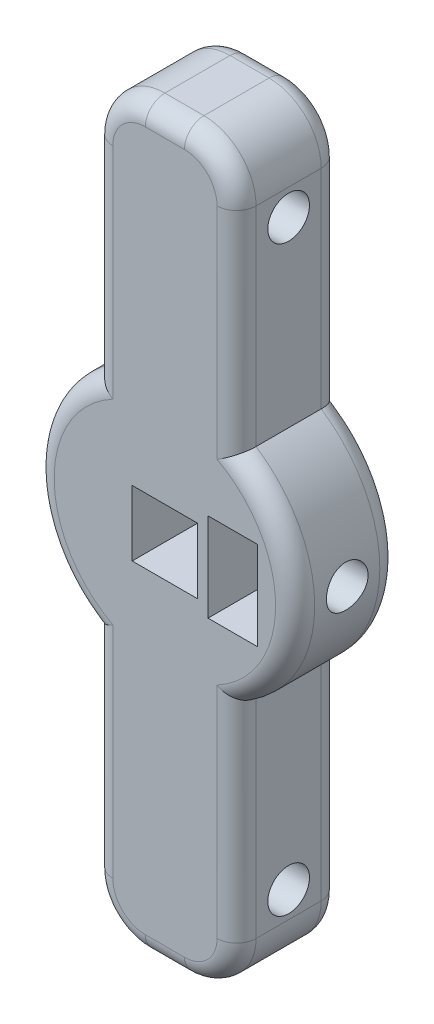
from build123d import *

# Parameters (mm, degrees)
SKETCH2_R           = 2.032
BOSS_EXTRUDE1_DEPTH = 10.16
SKETCH3_W           = 6.38
SKETCH3_H           = 6.38
CUT_EXTRUDE1_DEPTH  = 40.509368553
SKETCH4_R           = 2.032
CUT_EXTRUDE2_DEPTH  = 24.13
FILLET3_R           = 1.905
FILLET1_R           = 5.08
SKETCH5_R           = 2.032
CUT_EXTRUDE3_DEPTH  = 41.64716852
SKETCH7_W           = 10.16
SKETCH7_H           = 8.636
CUT_EXTRUDE4_DEPTH  = 5.842
SKETCH8_W           = 10.16
SKETCH8_H           = 8.636
BOSS_EXTRUDE2_DEPTH = 1.016


with BuildPart() as part:
    # Sketch2 → Boss-Extrude1 (new body)
    with BuildSketch(Plane.XY):
        with BuildLine():
            Line((-6.985, 10.606591111), (-6.985, 36.006591111))
            Line((-6.985, 36.006591111), (6.985, 36.006591111))
            Line((6.985, 36.006591111), (6.985, 10.606591111))
            ThreePointArc((6.985, 10.606591111), (12.7, 0), (6.985, -10.606591111))
            Line((6.985, -10.606591111), (6.985, -36.006591111))
            Line((6.985, -36.006591111), (-6.985, -36.006591111))
            Line((-6.985, -36.006591111), (-6.985, -10.606591111))
            ThreePointArc((-6.985, -10.606591111), (-12.7, 0), (-6.985, 10.606591111))
        make_face()
        Circle(SKETCH2_R, mode=Mode.SUBTRACT)
    extrude(amount=BOSS_EXTRUDE1_DEPTH)

    # Sketch3 → Cut-Extrude1 (cut, through all)
    with BuildSketch(Plane(origin=(0, 0, 0), x_dir=(-1, 0, 0), z_dir=(0, 0, -1))):
        Rectangle(SKETCH3_W, SKETCH3_H)
    extrude(amount=-CUT_EXTRUDE1_DEPTH, mode=Mode.SUBTRACT)

    # Sketch4 → Cut-Extrude2 (cut)
    with BuildSketch(Plane(origin=(6.985, 0, 3.175), x_dir=(0, 0, 1), z_dir=(-1, 0, 0))):
        with Locations(Location((1.905, 28.386591111, 0), (0, 0, 90))):
            Circle(SKETCH4_R)
        with Locations(Location((1.905, -28.386591111, 0), (0, 0, 90))):
            Circle(SKETCH4_R)
    extrude(amount=CUT_EXTRUDE2_DEPTH, mode=Mode.SUBTRACT)

    # Fillet3
    fillet3_edges = [part.edges().sort_by_distance(p)[0] for p in [
        (6.985, 23.306591111, 0),
        (12.7, 0, 0),
        (6.985, -23.306591111, 0),
        (0, -36.006591111, 0),
        (12.7, 0, 10.16),
        (6.985, 23.306591111, 10.16),
        (0, 36.006591111, 10.16),
        (-6.985, 23.306591111, 10.16),
        (-12.7, 0, 10.16),
        (-6.985, -23.306591111, 10.16),
        (0, -36.006591111, 10.16),
        (-6.985, -23.306591111, 0),
        (6.985, -23.306591111, 10.16),
        (-12.7, 0, 0),
        (-6.985, 23.306591111, 0),
        (0, 36.006591111, 0),
    ]]
    fillet(fillet3_edges, radius=FILLET3_R)

    # Fillet1
    # the kernel refuses this fillet: 5.08 mm, written as the material it takes off along each edge
    with BuildSketch(Plane(origin=(-1.905, 30.926591111, 0), x_dir=(-1, 0, 0), z_dir=(0, -1, 0))) as fillet1_piece_1:
        with BuildLine():
            CenterArc((3.175, -1.905), 1.905, 0, 90)
            Line((5.08, -1.905), (5.08, 0))
            Line((5.08, 0), (3.175, 0))
        make_face()
    revolve(axis=Axis((-1.905, 30.926591111, 0), (0, 0, -1)), revolution_arc=90, mode=Mode.SUBTRACT)
    with BuildSketch(Plane(origin=(1.905, 30.926591111, 0), x_dir=(0, 1, 0), z_dir=(-1, 0, 0))) as fillet1_piece_2:
        with BuildLine():
            CenterArc((3.175, -1.905), 1.905, 0, 90)
            Line((5.08, -1.905), (5.08, 0))
            Line((5.08, 0), (3.175, 0))
        make_face()
    revolve(axis=Axis((1.905, 30.926591111, 0), (0, 0, -1)), revolution_arc=90, mode=Mode.SUBTRACT)
    with BuildSketch(Plane(origin=(-1.905, -30.926591111, 0), x_dir=(0, -1, 0), z_dir=(1, 0, 0))) as fillet1_piece_3:
        with BuildLine():
            CenterArc((3.175, -1.905), 1.905, 0, 90)
            Line((5.08, -1.905), (5.08, 0))
            Line((5.08, 0), (3.175, 0))
        make_face()
    revolve(axis=Axis((-1.905, -30.926591111, 0), (0, 0, -1)), revolution_arc=90, mode=Mode.SUBTRACT)
    with BuildSketch(Plane(origin=(1.905, -30.926591111, 0), x_dir=(1, 0, 0), z_dir=(0, 1, 0))) as fillet1_piece_4:
        with BuildLine():
            CenterArc((3.175, -1.905), 1.905, 0, 90)
            Line((5.08, -1.905), (5.08, 0))
            Line((5.08, 0), (3.175, 0))
        make_face()
    revolve(axis=Axis((1.905, -30.926591111, 0), (0, 0, -1)), revolution_arc=90, mode=Mode.SUBTRACT)
    with BuildSketch(Plane(origin=(-1.905, 30.926591111, 10.16), x_dir=(0, 1, 0), z_dir=(1, 0, 0))) as fillet1_piece_5:
        with BuildLine():
            CenterArc((3.175, -1.905), 1.905, 0, 90)
            Line((5.08, -1.905), (5.08, 0))
            Line((5.08, 0), (3.175, 0))
        make_face()
    revolve(axis=Axis((-1.905, 30.926591111, 10.16), (0, 0, 1)), revolution_arc=90, mode=Mode.SUBTRACT)
    with BuildSketch(Plane(origin=(1.905, 30.926591111, 10.16), x_dir=(1, 0, 0), z_dir=(0, -1, 0))) as fillet1_piece_6:
        with BuildLine():
            CenterArc((3.175, -1.905), 1.905, 0, 90)
            Line((5.08, -1.905), (5.08, 0))
            Line((5.08, 0), (3.175, 0))
        make_face()
    revolve(axis=Axis((1.905, 30.926591111, 10.16), (0, 0, 1)), revolution_arc=90, mode=Mode.SUBTRACT)
    with BuildSketch(Plane(origin=(-1.905, -30.926591111, 10.16), x_dir=(-1, 0, 0), z_dir=(0, 1, 0))) as fillet1_piece_7:
        with BuildLine():
            CenterArc((3.175, -1.905), 1.905, 0, 90)
            Line((5.08, -1.905), (5.08, 0))
            Line((5.08, 0), (3.175, 0))
        make_face()
    revolve(axis=Axis((-1.905, -30.926591111, 10.16), (0, 0, 1)), revolution_arc=90, mode=Mode.SUBTRACT)
    with BuildSketch(Plane(origin=(1.905, -30.926591111, 10.16), x_dir=(0, -1, 0), z_dir=(-1, 0, 0))) as fillet1_piece_8:
        with BuildLine():
            CenterArc((3.175, -1.905), 1.905, 0, 90)
            Line((5.08, -1.905), (5.08, 0))
            Line((5.08, 0), (3.175, 0))
        make_face()
    revolve(axis=Axis((1.905, -30.926591111, 10.16), (0, 0, 1)), revolution_arc=90, mode=Mode.SUBTRACT)
    with BuildSketch(Plane(origin=(6.985, -36.006591111, 0), x_dir=(-1, 0, 0), z_dir=(0, 0, 1)), Plane(origin=(-6.985, -36.006591111, 0), x_dir=(0, 1, 0), z_dir=(0, 0, 1))) as fillet1_piece_9:
        with BuildLine():
            CenterArc((FILLET1_R, -FILLET1_R), FILLET1_R, 90, 90)
            Line((0, -FILLET1_R), (0, 0))
            Line((0, 0), (FILLET1_R, 0))
        make_face()
    extrude(amount=10.16, mode=Mode.SUBTRACT)
    with BuildSketch(Plane(origin=(-6.985, 36.006591111, 0), x_dir=(0, -1, 0), z_dir=(0, 0, 1)), Plane(origin=(6.985, 36.006591111, 0), x_dir=(-1, 0, 0), z_dir=(0, 0, 1))) as fillet1_piece_10:
        with BuildLine():
            CenterArc((FILLET1_R, FILLET1_R), FILLET1_R, 180, 90)
            Line((0, FILLET1_R), (0, 0))
            Line((0, 0), (FILLET1_R, 0))
        make_face()
    extrude(amount=10.16, mode=Mode.SUBTRACT)

    # Sketch5 → Cut-Extrude3 (cut, through all)
    with BuildSketch(Plane.ZY.offset(-3.19)):
        with Locations(Location((5.08, 0, 0), (0, 0, 270))):
            Circle(SKETCH5_R)
    extrude(amount=-CUT_EXTRUDE3_DEPTH, mode=Mode.SUBTRACT)

    # Sketch7 → Cut-Extrude4 (cut)
    with BuildSketch(Plane.ZY.offset(-3.19)):
        with Locations((5.08, 0)):
            Rectangle(SKETCH7_W, SKETCH7_H)
    extrude(amount=-CUT_EXTRUDE4_DEPTH, mode=Mode.SUBTRACT)

    # Sketch8 → Boss-Extrude2 (add)
    with BuildSketch(Plane(origin=(3.19, 0, 0), x_dir=(0, 0, -1), z_dir=(1, 0, 0))):
        with Locations((-5.08, 0)):
            Rectangle(SKETCH8_W, SKETCH8_H)
    extrude(amount=BOSS_EXTRUDE2_DEPTH)


solid = part.part
